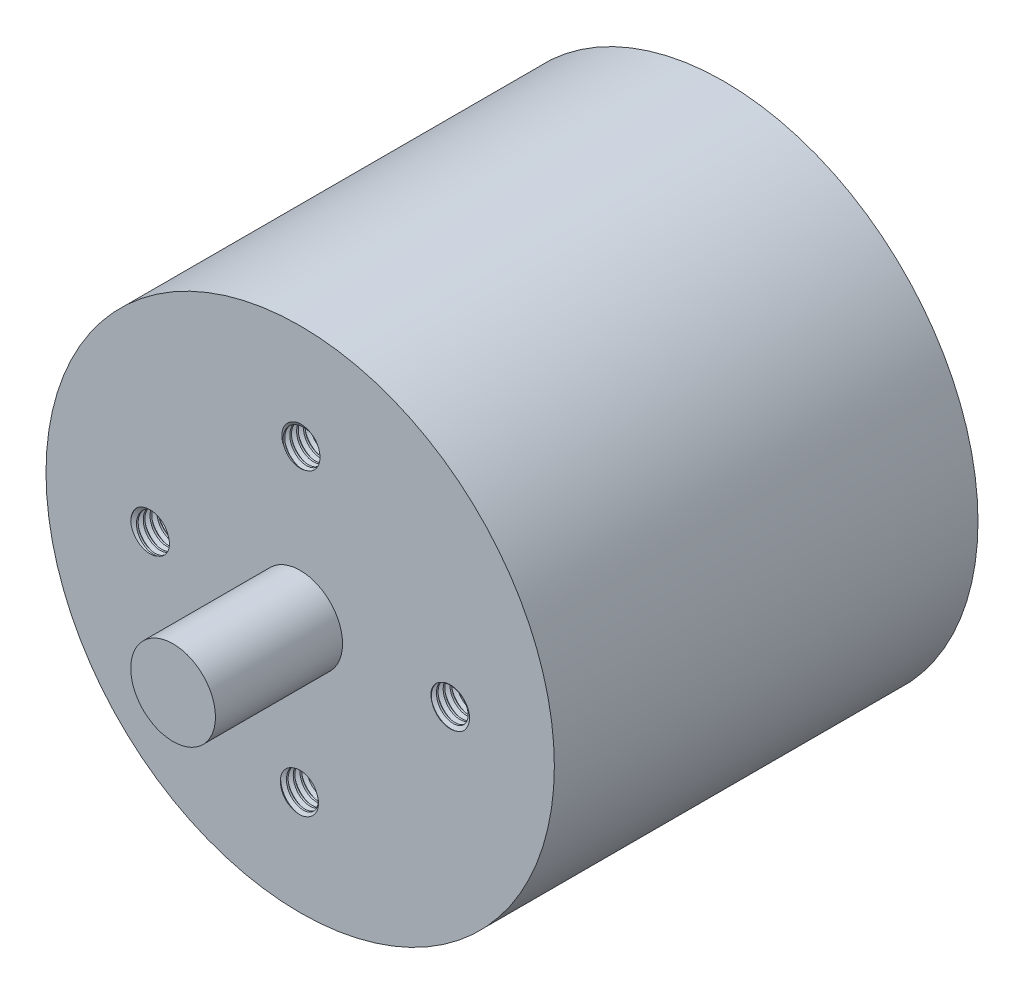
from build123d import *

# Parameters (mm, degrees)
SKETCH1_R           = 30
BOSS_EXTRUDE1_DEPTH = 50
SKETCH2_R           = 5
BOSS_EXTRUDE2_DEPTH = 15
SKETCH3_R           = 2.5
CUT_EXTRUDE1_DEPTH  = 5
THREAD1_PITCH       = 0.8
CIRPATTERN1_COUNT   = 4
SKETCH9_R           = 30
SKETCH9_R_2         = 10.524095195
CUT_EXTRUDE2_DEPTH  = 5


with BuildPart() as part:
    # Sketch1 → Boss-Extrude1 (new body)
    with BuildSketch(Plane.XY):
        Circle(SKETCH1_R)
    extrude(amount=BOSS_EXTRUDE1_DEPTH)

    # Sketch2 → Boss-Extrude2 (add)
    with BuildSketch(Plane.XY.offset(50)):
        Circle(SKETCH2_R)
    extrude(amount=BOSS_EXTRUDE2_DEPTH)

    # Sketch3 → Cut-Extrude1 (cut)
    with BuildSketch(Plane.XY.offset(50)):
        with Locations((0, 17.5)):
            Circle(SKETCH3_R)
        with Locations((17.5, 0)):
            Circle(SKETCH3_R)
        with Locations((0, -17.5)):
            Circle(SKETCH3_R)
        with Locations((-17.5, 0)):
            Circle(SKETCH3_R)
    extrude(amount=-CUT_EXTRUDE1_DEPTH, mode=Mode.SUBTRACT)

    # Thread1: the profile of Thread Profile1 profile screwed along a right-hand helix of 7.5 turns, 8 arcs to a turn; built about Z, then put on its axis
    thread1_z = Axis((0, 0, 0), (0, 0, 1))
    thread1_corners = [(2.5003, 0, -0.000173205), (2.5003, 0, 0.700173203), (2.0669873, 0, 0.449999999), (2.0669873, 0, 0.249999999)]
    with BuildLine(mode=Mode.PRIVATE) as thread1_profile:
        Line(thread1_corners[0], thread1_corners[1])
        Line(thread1_corners[1], thread1_corners[2])
        Line(thread1_corners[2], thread1_corners[3])
        Line(thread1_corners[3], thread1_corners[0])
    thread1_cap = Face(thread1_profile.wire())
    thread1_turn_angles = [0, 22.5, 45, 67.5, 90, 112.5, 135, 157.5, 180, 202.5, 225, 247.5, 270, 292.5, 315, 337.5, 360]
    thread1_turn_weights = [1, 0.9238795325112867, 1, 0.9238795325112867, 1, 0.9238795325112867, 1, 0.9238795325112867, 1, 0.9238795325112867, 1, 0.9238795325112867, 1, 0.9238795325112867, 1, 0.9238795325112867, 1]
    thread1_turn_rails = [Edge.make_bspline([Vector(p[0], p[1], 0).rotate(thread1_z, thread1_turn_angles[k]) / thread1_turn_weights[k] + Vector(0, 0, p[2] + THREAD1_PITCH * thread1_turn_angles[k] / 360) for k in range(17)], [0, 0, 0, 1, 1, 2, 2, 3, 3, 4, 4, 5, 5, 6, 6, 7, 7, 8, 8, 8], 2, thread1_turn_weights) for p in thread1_corners]
    thread1_turn_sides = [Face.make_surface_from_curves(thread1_turn_rails[p[0]], thread1_turn_rails[p[1]]) for p in [(0, 1), (1, 2), (2, 3), (3, 0)]]
    thread1_last_angles = [2520, 2542.5, 2565, 2587.5, 2610, 2632.5, 2655, 2677.5, 2700]
    thread1_last_weights = [1, 0.9238795325112867, 1, 0.9238795325112867, 1, 0.9238795325112867, 1, 0.9238795325112867, 1]
    thread1_last_rails = [Edge.make_bspline([Vector(p[0], p[1], 0).rotate(thread1_z, thread1_last_angles[k]) / thread1_last_weights[k] + Vector(0, 0, p[2] + THREAD1_PITCH * thread1_last_angles[k] / 360) for k in range(9)], [0, 0, 0, 1, 1, 2, 2, 3, 3, 4, 4, 4], 2, thread1_last_weights) for p in thread1_corners]
    thread1_last_sides = [Face.make_surface_from_curves(thread1_last_rails[p[0]], thread1_last_rails[p[1]]) for p in [(0, 1), (1, 2), (2, 3), (3, 0)]]
    thread1 = Plane(origin=(0, 17.5, 51), x_dir=(-1, 0, 0), z_dir=(0, 0, -1)) * Solid(Shell([*[p.moved(Location((0, 0, THREAD1_PITCH * i))) for i in range(7) for p in thread1_turn_sides], *thread1_last_sides, thread1_cap, thread1_cap.rotate(thread1_z, 2700).moved(Location((0, 0, THREAD1_PITCH * 2700 / 360)))]))
    add(thread1)

    # CirPattern1: Thread1 ×4 about axis
    cirpattern1_axis = Axis((0, 0, 50), (0, 0, 1))
    for i in range(1, CIRPATTERN1_COUNT):
        add(thread1.rotate(cirpattern1_axis, i * 360 / CIRPATTERN1_COUNT))

    # Sketch9 → Cut-Extrude2 (cut)
    with BuildSketch(Plane.XY.offset(50)):
        Circle(SKETCH9_R)
        Circle(SKETCH9_R_2, mode=Mode.SUBTRACT)
    extrude(amount=CUT_EXTRUDE2_DEPTH, mode=Mode.SUBTRACT)


solid = part.part
